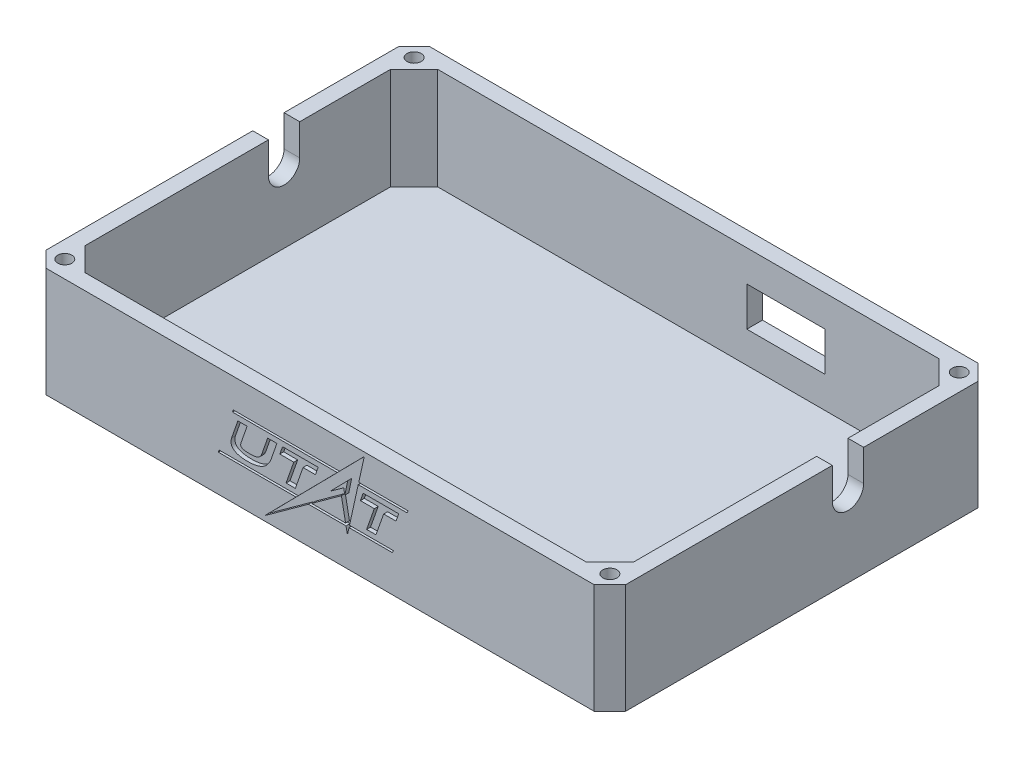
from build123d import *

# Parameters (mm, degrees)
SKETCH1_W           = 74
SKETCH1_H           = 49
SKETCH1_W_2         = 70
SKETCH1_H_2         = 45
BOSS_EXTRUDE1_DEPTH = 13
SKETCH2_W           = 74
SKETCH2_H           = 49
BOSS_EXTRUDE2_DEPTH = 1
CHAMFER1_SIZE       = 3
CHAMFER2_SIZE       = 2
SKETCH3_R           = 0.9
CUT_EXTRUDE1_DEPTH  = 6
CUT_EXTRUDE2_DEPTH  = 86
SKETCH5_W           = 10
SKETCH5_H           = 5
CUT_EXTRUDE3_DEPTH  = 6
CUT_EXTRUDE4_DEPTH  = 0.5
CUT_EXTRUDE5_START  = -0.5
CUT_EXTRUDE5_DEPTH  = 0.5


# Read off the part's stored shape, not the designer's step: Cut-Extrude5
with BuildPart() as part:
    # Sketch1 → Boss-Extrude1 (new body)
    with BuildSketch(Plane(origin=(0, 0, 0), x_dir=(1, 0, 0), z_dir=(0, 1, 0))):
        Rectangle(SKETCH1_W, SKETCH1_H)
        Rectangle(SKETCH1_W_2, SKETCH1_H_2, mode=Mode.SUBTRACT)
    extrude(amount=BOSS_EXTRUDE1_DEPTH)

    # Sketch2 → Boss-Extrude2 (add)
    with BuildSketch(Plane.XZ):
        Rectangle(SKETCH2_W, SKETCH2_H)
    extrude(amount=BOSS_EXTRUDE2_DEPTH)

    # Chamfer1
    chamfer1_edges = [part.edges().sort_by_distance(p)[0] for p in [
        (35, 6.5, 22.5),
        (35, 6.5, -22.5),
        (-35, 6.5, -22.5),
        (-35, 6.5, 22.5),
    ]]
    chamfer(chamfer1_edges, length=CHAMFER1_SIZE)

    # Chamfer2
    chamfer2_edges = [part.edges().sort_by_distance(p)[0] for p in [
        (37, 6, 24.5),
        (-37, 6, 24.5),
        (-37, 6, -24.5),
        (37, 6, -24.5),
    ]]
    chamfer(chamfer2_edges, length=CHAMFER2_SIZE)

    # Sketch3 → Cut-Extrude1 (cut)
    with BuildSketch(Plane(origin=(0, 13, 0), x_dir=(1, 0, 0), z_dir=(0, 1, 0))):
        with Locations(Location((-34.8, 22.3, 0), (0, 0, 270))):
            Circle(SKETCH3_R)
        with Locations(Location((34.8, 22.3, 0), (0, 0, 270))):
            Circle(SKETCH3_R)
        with Locations(Location((34.8, -22.3, 0), (0, 0, 270))):
            Circle(SKETCH3_R)
        with Locations(Location((-34.8, -22.3, 0), (0, 0, 270))):
            Circle(SKETCH3_R)
    extrude(amount=-CUT_EXTRUDE1_DEPTH, mode=Mode.SUBTRACT)

    # Sketch4 → Cut-Extrude2 (cut)
    with BuildSketch(Plane(origin=(37, 0, 0), x_dir=(0, 0, -1), z_dir=(1, 0, 0))):
        with BuildLine():
            Line((3.897991901, 9), (3.897991901, 13))
            Line((3.897991901, 13), (7.897991901, 13))
            Line((7.897991901, 13), (7.897991901, 9))
            ThreePointArc((7.897991901, 9), (5.897991901, 7), (3.897991901, 9))
        make_face()
    extrude(amount=-CUT_EXTRUDE2_DEPTH, mode=Mode.SUBTRACT)

    # Sketch5 → Cut-Extrude3 (cut)
    with BuildSketch(Plane(origin=(0, 0, -24.5), x_dir=(-1, 0, 0), z_dir=(0, 0, -1))):
        with Locations((-12.479644564, 6.5)):
            Rectangle(SKETCH5_W, SKETCH5_H)
    extrude(amount=-CUT_EXTRUDE3_DEPTH, mode=Mode.SUBTRACT)

    # Sketch7 → Cut-Extrude4 (cut)
    # profile 1 of 7: a face of its own
    with BuildSketch(Plane(origin=(0, 0, -24.5), x_dir=(-1, 0, 0), z_dir=(0, 0, -1))):
        with BuildLine():
            Line((1.708011202, 9.169338726), (4.117457984, 9.169338726))
            Line((4.117457984, 9.169338726), (4.117457984, 8.287394282))
            Line((4.117457984, 8.287394282), (2.460632062, 8.287394282))
            Line((2.460632062, 8.287394282), (2.253926333, 7.286726546))
            add(Edge.make_bspline(
                [(2.253926333, 7.286726546), (2.282092948, 7.294571304), (2.337643299, 7.310042778), (2.421329971, 7.325558709), (2.50243402, 7.335615642), (2.555654001, 7.336957103), (2.581475412, 7.337607957)],
                knots=[0, 0, 0, 0, 1.05461699, 2.079921384, 3.068411212, 4, 4, 4, 4], degree=3))
            add(Edge.make_bspline(
                [(2.581475412, 7.337607957), (2.63774297, 7.336318618), (2.748658723, 7.333777048), (2.910914395, 7.309649257), (3.066283785, 7.271648717), (3.214291448, 7.217452106), (3.354792798, 7.146913818), (3.487958152, 7.061582263), (3.613950947, 6.961307567), (3.730533021, 6.84602695), (3.8376535, 6.719446223), (3.930788647, 6.582535772), (4.010331875, 6.437247809), (4.073597808, 6.282679225), (4.123532677, 6.119800817), (4.159616727, 5.948508205), (4.180955029, 5.768598384), (4.183832369, 5.645858775), (4.185299864, 5.583259332)],
                knots=[0, 0, 0, 0, 1.01440847, 1.999622559, 2.951875003, 3.895578053, 4.836219714, 5.782137149, 6.743708247, 7.735272588, 8.734977101, 9.730283169, 10.717124674, 11.717316708, 12.737475749, 13.78628267, 14.87096371, 16, 16, 16, 16], degree=3))
            add(Edge.make_bspline(
                [(4.185299864, 5.583259332), (4.183506561, 5.519949241), (4.17996785, 5.395019923), (4.156881001, 5.211329636), (4.116132298, 5.03539581), (4.060159877, 4.866747474), (3.986419795, 4.706624153), (3.897737255, 4.553367088), (3.792612874, 4.408113859), (3.672078281, 4.272353486), (3.541041368, 4.1482659), (3.401517988, 4.039105812), (3.254488335, 3.947248483), (3.09994886, 3.873012231), (2.938786207, 3.81427783), (2.77095146, 3.77152199), (2.595628965, 3.747003891), (2.47660777, 3.743678534), (2.416110828, 3.741988299)],
                knots=[0, 0, 0, 0, 1.06808661, 2.107647099, 3.116961351, 4.110378221, 5.100014249, 6.085620622, 7.093190682, 8.119403071, 9.144090782, 10.133780668, 11.103064255, 12.062861538, 13.020824475, 13.992378307, 14.979551724, 16, 16, 16, 16], degree=3))
            add(Edge.make_bspline(
                [(2.416110828, 3.741988299), (2.362010214, 3.743371017), (2.255312481, 3.746098026), (2.098151404, 3.762859664), (1.946630673, 3.792494396), (1.801554698, 3.835383527), (1.661397038, 3.888170256), (1.527777954, 3.954190037), (1.399963187, 4.032185763), (1.278315682, 4.120734011), (1.16481204, 4.220480179), (1.061217941, 4.329669544), (0.966906216, 4.44692583), (0.883894987, 4.573695622), (0.812444469, 4.709791625), (0.749080692, 4.853609916), (0.697216806, 5.006652417), (0.670897377, 5.112749982), (0.657522086, 5.166667786)],
                knots=[0, 0, 0, 0, 1.054957082, 2.080596141, 3.077793124, 4.061112343, 5.027190972, 5.994718051, 6.962465889, 7.943658696, 8.924948258, 9.904494768, 10.875059, 11.855380583, 12.854004648, 13.869083016, 14.917087635, 16, 16, 16, 16], degree=3))
            Line((0.657522086, 5.166667786), (1.742992172, 5.166667786))
            add(Edge.make_bspline(
                [(1.742992172, 5.166667786), (1.762834591, 5.129304943), (1.801396069, 5.056694522), (1.874748524, 4.960293278), (1.956861941, 4.878086439), (2.046995612, 4.809270826), (2.145733547, 4.757715339), (2.249052362, 4.718618044), (2.358250006, 4.696025165), (2.432618424, 4.693200831), (2.470172327, 4.691774623)],
                knots=[0, 0, 0, 0, 1.104910296, 2.147267069, 3.153527244, 4.136738762, 5.099945312, 6.05603338, 7.018353, 8, 8, 8, 8], degree=3))
            add(Edge.make_bspline(
                [(2.470172327, 4.691774623), (2.496346893, 4.692759432), (2.547845794, 4.694697059), (2.623721281, 4.704947593), (2.696147766, 4.724361871), (2.765663724, 4.751246134), (2.832455892, 4.784773846), (2.895566781, 4.827100398), (2.956094407, 4.875819828), (3.013117294, 4.93172554), (3.064763594, 4.994047404), (3.110051749, 5.061016496), (3.150545605, 5.131144747), (3.180540023, 5.207210114), (3.205102916, 5.286941258), (3.223192023, 5.370939616), (3.234002305, 5.45930329), (3.235003048, 5.519626693), (3.235513539, 5.550398421)],
                knots=[0, 0, 0, 0, 0.978869489, 1.925942215, 2.855067702, 3.774946051, 4.70828698, 5.642468714, 6.60995405, 7.609372294, 8.622401667, 9.629904756, 10.629323, 11.642352373, 12.678539694, 13.745912462, 14.850161547, 16, 16, 16, 16], degree=3))
            add(Edge.make_bspline(
                [(3.235513539, 5.550398421), (3.234921055, 5.580455868), (3.233767769, 5.638963417), (3.224227561, 5.724873457), (3.207160313, 5.806386536), (3.183906041, 5.884126986), (3.154137796, 5.957622727), (3.117759012, 6.027311243), (3.074614273, 6.092840282), (3.024471945, 6.152875739), (2.971000682, 6.207941968), (2.913555365, 6.256102452), (2.852653544, 6.296072311), (2.790187668, 6.33096716), (2.723664325, 6.356362871), (2.654579357, 6.37385196), (2.583005417, 6.38668475), (2.534186386, 6.387438723), (2.509393414, 6.387821632)],
                knots=[0, 0, 0, 0, 1.166249705, 2.270133367, 3.348514167, 4.393962215, 5.415026464, 6.420877785, 7.440098956, 8.453121383, 9.451844239, 10.415694839, 11.355045125, 12.27538808, 13.187007209, 14.108269027, 15.039275622, 16, 16, 16, 16], degree=3))
            add(Edge.make_bspline(
                [(2.509393414, 6.387821632), (2.482462484, 6.386799753), (2.428487122, 6.384751688), (2.348293244, 6.368087129), (2.269066282, 6.341117622), (2.190365651, 6.303908912), (2.112972592, 6.255214452), (2.034844664, 6.198101433), (1.958596977, 6.128420052), (1.910116577, 6.076521201), (1.885036109, 6.04967226)],
                knots=[0, 0, 0, 0, 0.88288272, 1.769486374, 2.674910571, 3.623812639, 4.617874466, 5.670434592, 6.794841017, 8, 8, 8, 8], degree=3))
            Line((1.885036109, 6.04967226), (1.085773956, 6.233057342))
            Line((1.085773956, 6.233057342), (1.708011202, 9.169338726))
        make_face()
    # profile 2 of 7: a face of its own
    with BuildSketch(Plane(origin=(0, 0, -24.5), x_dir=(-1, 0, 0), z_dir=(0, 0, -1))):
        Polygon((4.761955847, 9.169338726), (5.776403964, 9.169338726), (7.136421659, 5.410474543), (8.499619442, 9.169338726), (9.510887471, 9.169338726), (7.592234293, 3.877672059), (6.677428937, 3.877672059), align=None)
    # profile 3 of 7: a face of its own
    with BuildSketch(Plane(origin=(0, 0, -24.5), x_dir=(-1, 0, 0), z_dir=(0, 0, -1))):
        Polygon((9.884017813, 2.927885735), (12.3189053, 9.305022487), (13.038665249, 9.305022487), (10.603777762, 2.927885735), align=None)
    # profile 4 of 7: a face of its own
    with BuildSketch(Plane(origin=(0, 0, -24.5), x_dir=(-1, 0, 0), z_dir=(0, 0, -1))):
        Polygon((13.547479351, 9.169338726), (16.939573368, 9.169338726), (16.939573368, 8.676425064), (14.605388673, 3.741988299), (13.763725345, 4.166000051), (15.714179405, 8.287394282), (13.547479351, 8.287394282), align=None)
    # profile 5 of 7: a face of its own
    with BuildSketch(Plane(origin=(0, 0, -24.5), x_dir=(-1, 0, 0), z_dir=(0, 0, -1))):
        with BuildLine():
            add(Edge.make_bspline(
                [(18.194648155, 4.963142145), (18.232989903, 4.961039959), (18.308478182, 4.956901118), (18.417548453, 4.92601338), (18.515985001, 4.87051916), (18.604000427, 4.798136567), (18.678424055, 4.711050644), (18.732215771, 4.611739796), (18.765713221, 4.503089788), (18.769411363, 4.427364013), (18.771304138, 4.388606221)],
                knots=[0, 0, 0, 0, 1.016957001, 2.002212695, 2.9757545, 3.99499976, 5.013036768, 5.994806404, 6.97370641, 8, 8, 8, 8], degree=3))
            add(Edge.make_bspline(
                [(18.771304138, 4.388606221), (18.769423763, 4.349842204), (18.765749847, 4.274104267), (18.731983972, 4.165242546), (18.678504437, 4.065115454), (18.603994456, 3.977096348), (18.516349503, 3.903349637), (18.41732213, 3.848367155), (18.308685959, 3.815727234), (18.233026474, 3.811814776), (18.194648155, 3.809830179)],
                knots=[0, 0, 0, 0, 1.023218912, 1.999186227, 2.986238111, 4.008388923, 5.030539734, 6.0011649, 6.986089706, 8, 8, 8, 8], degree=3))
            add(Edge.make_bspline(
                [(18.194648155, 3.809830179), (18.156260742, 3.811798638), (18.08058333, 3.815679282), (17.971778291, 3.848642277), (17.872019821, 3.902982553), (17.784352847, 3.977185802), (17.709509988, 4.064803771), (17.657550926, 4.165558465), (17.623470531, 4.274063225), (17.619846841, 4.349828309), (17.617992172, 4.388606221)],
                knots=[0, 0, 0, 0, 1.013427518, 1.99788335, 2.976245624, 3.997909735, 5.019573847, 6.001765691, 6.977268297, 8, 8, 8, 8], degree=3))
            add(Edge.make_bspline(
                [(17.617992172, 4.388606221), (17.619859077, 4.42737815), (17.623506674, 4.503131544), (17.657319788, 4.611420238), (17.709593262, 4.711364021), (17.784346605, 4.798046926), (17.872386201, 4.870883378), (17.971550698, 4.925742028), (18.080791002, 4.956949425), (18.15629727, 4.96105623), (18.194648155, 4.963142145)],
                knots=[0, 0, 0, 0, 1.025808215, 2.00424526, 2.981110158, 3.998665696, 5.017428914, 5.998734231, 6.983523959, 8, 8, 8, 8], degree=3))
        make_face()
    # profile 6 of 7: a face of its own
    with BuildSketch(Plane(origin=(0, 0, -24.5), x_dir=(-1, 0, 0), z_dir=(0, 0, -1))):
        with BuildLine():
            Line((20.432370177, 9.169338726), (22.841816958, 9.169338726))
            Line((22.841816958, 9.169338726), (22.841816958, 8.287394282))
            Line((22.841816958, 8.287394282), (21.184991037, 8.287394282))
            Line((21.184991037, 8.287394282), (20.978285308, 7.286726546))
            add(Edge.make_bspline(
                [(20.978285308, 7.286726546), (21.006451922, 7.294571304), (21.062002273, 7.310042778), (21.145688946, 7.325558709), (21.226792994, 7.335615642), (21.280012976, 7.336957103), (21.305834386, 7.337607957)],
                knots=[0, 0, 0, 0, 1.05461699, 2.079921384, 3.068411212, 4, 4, 4, 4], degree=3))
            add(Edge.make_bspline(
                [(21.305834386, 7.337607957), (21.362101944, 7.336318618), (21.473017697, 7.333777048), (21.635273369, 7.309649257), (21.79064276, 7.271648717), (21.938650422, 7.217452106), (22.079151772, 7.146913818), (22.212317126, 7.061582263), (22.338309921, 6.961307567), (22.454891995, 6.84602695), (22.562012474, 6.719446223), (22.655147622, 6.582535772), (22.734690849, 6.437247809), (22.797956783, 6.282679225), (22.847891651, 6.119800817), (22.883975702, 5.948508205), (22.905314004, 5.768598384), (22.908191343, 5.645858775), (22.909658839, 5.583259332)],
                knots=[0, 0, 0, 0, 1.01440847, 1.999622559, 2.951875003, 3.895578053, 4.836219714, 5.782137149, 6.743708247, 7.735272588, 8.734977101, 9.730283169, 10.717124674, 11.717316708, 12.737475749, 13.78628267, 14.87096371, 16, 16, 16, 16], degree=3))
            add(Edge.make_bspline(
                [(22.909658839, 5.583259332), (22.907865535, 5.519949241), (22.904326824, 5.395019923), (22.881239975, 5.211329636), (22.840491272, 5.03539581), (22.784518851, 4.866747474), (22.71077877, 4.706624153), (22.622096229, 4.553367088), (22.516971848, 4.408113859), (22.396437256, 4.272353486), (22.265400343, 4.1482659), (22.125876962, 4.039105812), (21.978847309, 3.947248483), (21.824307835, 3.873012231), (21.663145181, 3.81427783), (21.495310435, 3.77152199), (21.319987939, 3.747003891), (21.200966745, 3.743678534), (21.140469803, 3.741988299)],
                knots=[0, 0, 0, 0, 1.06808661, 2.107647099, 3.116961351, 4.110378221, 5.100014249, 6.085620622, 7.093190682, 8.119403071, 9.144090782, 10.133780668, 11.103064255, 12.062861538, 13.020824475, 13.992378307, 14.979551724, 16, 16, 16, 16], degree=3))
            add(Edge.make_bspline(
                [(21.140469803, 3.741988299), (21.086369188, 3.743371017), (20.979671455, 3.746098026), (20.822510378, 3.762859664), (20.670989647, 3.792494396), (20.525913673, 3.835383527), (20.385756012, 3.888170256), (20.252136928, 3.954190037), (20.124322161, 4.032185763), (20.002674657, 4.120734011), (19.889171014, 4.220480179), (19.785576916, 4.329669544), (19.69126519, 4.44692583), (19.608253961, 4.573695622), (19.536803443, 4.709791625), (19.473439666, 4.853609916), (19.42157578, 5.006652417), (19.395256352, 5.112749982), (19.381881061, 5.166667786)],
                knots=[0, 0, 0, 0, 1.054957082, 2.080596141, 3.077793124, 4.061112343, 5.027190972, 5.994718051, 6.962465889, 7.943658696, 8.924948258, 9.904494768, 10.875059, 11.855380583, 12.854004648, 13.869083016, 14.917087635, 16, 16, 16, 16], degree=3))
            Line((19.381881061, 5.166667786), (20.467351146, 5.166667786))
            add(Edge.make_bspline(
                [(20.467351146, 5.166667786), (20.487193566, 5.129304943), (20.525755043, 5.056694522), (20.599107499, 4.960293278), (20.681220916, 4.878086439), (20.771354587, 4.809270826), (20.870092522, 4.757715339), (20.973411336, 4.718618044), (21.082608981, 4.696025165), (21.156977398, 4.693200831), (21.194531301, 4.691774623)],
                knots=[0, 0, 0, 0, 1.104910296, 2.147267069, 3.153527244, 4.136738762, 5.099945312, 6.05603338, 7.018353, 8, 8, 8, 8], degree=3))
            add(Edge.make_bspline(
                [(21.194531301, 4.691774623), (21.220705868, 4.692759432), (21.272204768, 4.694697059), (21.348080255, 4.704947593), (21.420506741, 4.724361871), (21.490022699, 4.751246134), (21.556814867, 4.784773846), (21.619925756, 4.827100398), (21.680453381, 4.875819828), (21.737476268, 4.93172554), (21.789122568, 4.994047404), (21.834410723, 5.061016496), (21.874904579, 5.131144747), (21.904898998, 5.207210114), (21.92946189, 5.286941258), (21.947550997, 5.370939616), (21.958361279, 5.45930329), (21.959362022, 5.519626693), (21.959872514, 5.550398421)],
                knots=[0, 0, 0, 0, 0.978869489, 1.925942215, 2.855067702, 3.774946051, 4.70828698, 5.642468714, 6.60995405, 7.609372294, 8.622401667, 9.629904756, 10.629323, 11.642352373, 12.678539694, 13.745912462, 14.850161547, 16, 16, 16, 16], degree=3))
            add(Edge.make_bspline(
                [(21.959872514, 5.550398421), (21.959280029, 5.580455868), (21.958126744, 5.638963417), (21.948586536, 5.724873457), (21.931519288, 5.806386536), (21.908265015, 5.884126986), (21.878496771, 5.957622727), (21.842117986, 6.027311243), (21.798973247, 6.092840282), (21.748830919, 6.152875739), (21.695359657, 6.207941968), (21.637914339, 6.256102452), (21.577012518, 6.296072311), (21.514546642, 6.33096716), (21.448023299, 6.356362871), (21.378938332, 6.37385196), (21.307364392, 6.38668475), (21.25854536, 6.387438723), (21.233752388, 6.387821632)],
                knots=[0, 0, 0, 0, 1.166249705, 2.270133367, 3.348514167, 4.393962215, 5.415026464, 6.420877785, 7.440098956, 8.453121383, 9.451844239, 10.415694839, 11.355045125, 12.27538808, 13.187007209, 14.108269027, 15.039275622, 16, 16, 16, 16], degree=3))
            add(Edge.make_bspline(
                [(21.233752388, 6.387821632), (21.206821458, 6.386799753), (21.152846097, 6.384751688), (21.072652219, 6.368087129), (20.993425256, 6.341117622), (20.914724625, 6.303908912), (20.837331566, 6.255214452), (20.759203639, 6.198101433), (20.682955951, 6.128420052), (20.634475551, 6.076521201), (20.609395083, 6.04967226)],
                knots=[0, 0, 0, 0, 0.88288272, 1.769486374, 2.674910571, 3.623812639, 4.617874466, 5.670434592, 6.794841017, 8, 8, 8, 8], degree=3))
            Line((20.609395083, 6.04967226), (19.81013293, 6.233057342))
            Line((19.81013293, 6.233057342), (20.432370177, 9.169338726))
        make_face()
    # profile 7 of 7: a face of its own
    with BuildSketch(Plane(origin=(0, 0, -24.5), x_dir=(-1, 0, 0), z_dir=(0, 0, -1))):
        Polygon((25.556552201, 9.169338726), (26.437436616, 9.169338726), (28.574455847, 3.877672059), (27.56000773, 3.877672059), (27.14871633, 4.963142145), (24.843152428, 4.963142145), (24.431861029, 3.877672059), (23.418472941, 3.877672059), align=None)
        Polygon((25.996464394, 7.749959386), (25.203562418, 5.91292847), (26.789366371, 5.91292847), align=None, mode=Mode.SUBTRACT)
    extrude(amount=-CUT_EXTRUDE4_DEPTH, mode=Mode.SUBTRACT)

    # Cut-Extrude5 outline → Cut-Extrude5 (cut)
    # profile 1 of 4: a face of its own
    with BuildSketch(Plane.XY.offset(24.5).offset(CUT_EXTRUDE5_START)):
        with BuildLine():
            Line((-10.50206592, 8.367500935), (-11.308391838, 6.070654049))
            add(Edge.make_bspline(
                [(-11.308391838, 6.070654049), (-11.332280287, 5.985404354), (-11.353613364, 5.891683859), (-11.377708974, 5.705399033), (-11.380784042, 5.61205075), (-11.361381515, 5.429382876), (-11.338924366, 5.339890457), (-11.262220114, 5.168900529), (-11.207901122, 5.087468229), (-11.063456079, 4.937933292), (-10.973283154, 4.869905836), (-10.757497773, 4.751033556), (-10.63190267, 4.700190153), (-10.209879262, 4.574944553), (-9.867575561, 4.527515458), (-9.138582622, 4.499199604), (-8.752868494, 4.517621895), (-8.206159127, 4.606808604), (-8.029233672, 4.647069721), (-7.695838591, 4.75086934), (-7.53945811, 4.814497259), (-7.254768892, 4.963913792), (-7.126585763, 5.049689333), (-6.90021496, 5.237213783), (-6.802034424, 5.338755948), (-6.629133138, 5.549567539), (-6.553948115, 5.658519205), (-6.451448552, 5.826429911), (-6.41900449, 5.883242863), (-6.358218166, 5.999514798), (-6.329800491, 6.059009247), (-6.305360251, 6.12042051)],
                knots=[0, 0, 0, 0, 0.0625, 0.0625, 0.125, 0.125, 0.1875, 0.1875, 0.25, 0.25, 0.3125, 0.3125, 0.375, 0.375, 0.5, 0.5, 0.625, 0.625, 0.6875, 0.6875, 0.75, 0.75, 0.8125, 0.8125, 0.875, 0.875, 0.9375, 0.9375, 0.96875, 0.96875, 1, 1, 1, 1], degree=3))
            Line((-6.305360251, 6.12042051), (-5.516505443, 8.367500935))
            Line((-5.516505443, 8.367500935), (-6.697855497, 8.367500967))
            Line((-6.697855497, 8.367500967), (-7.453951189, 6.213735475))
            add(Edge.make_bspline(
                [(-7.453951189, 6.213735475), (-7.470130504, 6.179684665), (-7.490693568, 6.137489646), (-7.537049291, 6.042608942), (-7.563513364, 5.990386993), (-7.630371629, 5.887253326), (-7.670996921, 5.836468896), (-7.771895905, 5.744028321), (-7.832184643, 5.702354229), (-7.972236154, 5.630981048), (-8.051931426, 5.601221349), (-8.22597153, 5.553070358), (-8.320238033, 5.534622956), (-8.614436324, 5.493090634), (-8.825008508, 5.48335732), (-9.222898445, 5.484514007), (-9.410180752, 5.495135854), (-9.731053074, 5.537103518), (-9.865236078, 5.568764126), (-10.011889277, 5.644685047), (-10.051654008, 5.674859658), (-10.110923474, 5.746403275), (-10.130323106, 5.787894331), (-10.149068471, 5.880115812), (-10.148188582, 5.931022939), (-10.13363287, 6.032060374), (-10.119549319, 6.082377695), (-10.11084506, 6.120420542)],
                knots=[0, 0, 0, 0, 0.0625, 0.0625, 0.125, 0.125, 0.1875, 0.1875, 0.25, 0.25, 0.3125, 0.3125, 0.375, 0.375, 0.5, 0.5, 0.625, 0.625, 0.75, 0.75, 0.8125, 0.8125, 0.875, 0.875, 0.9375, 0.9375, 1, 1, 1, 1], degree=3))
            Line((-10.11084506, 6.120420542), (-9.321989507, 8.367500935))
            Line((-9.321989507, 8.367500935), (-10.50206592, 8.367500935))
        make_face()
    # profile 2 of 4: a face of its own
    with BuildSketch(Plane.XY.offset(24.5).offset(CUT_EXTRUDE5_START)):
        Polygon((9.692388571, 7.378743697), (10.041267968, 8.367500935), (5.491848088, 8.367500935), (5.142526127, 7.372444976), (6.920374728, 7.372444976), (5.937367476, 4.586499293), (7.127079166, 4.586499293), (8.112308181, 7.378743697), align=None)
    # profile 3 of 4: a face of its own
    with BuildSketch(Plane.XY.offset(24.5).offset(CUT_EXTRUDE5_START)):
        Polygon((-0.599274241, 7.372444976), (-0.25002604, 8.367500935), (-4.797560551, 8.367500935), (-5.148660593, 7.372444976), (-3.365488925, 7.372444976), (-4.34847159, 4.571795199), (-3.163960033, 4.571795199), (-2.180977367, 7.372444976), align=None)
    # profile 4 of 4: a face of its own
    with BuildSketch(Plane.XY.offset(24.5).offset(CUT_EXTRUDE5_START)):
        Polygon((4.930240459, 9.286284927), (5.64073304, 12.5029375), (2.4692064, 9.286888424), (-11.082185261, 9.286888424), (-11.189742961, 9.002769847), (2.193761415, 9.002769847), (-2.790075742, 3.948968943), (-12.896867857, 3.948968943), (-13.000527971, 3.658133108), (-3.07688547, 3.658133108), (-7.067944311, -0.388952749), (-1.484134995, 3.658133108), (3.308158911, 3.658133108), (3.491228617, 2.771373574), (3.687930651, 3.661918376), (9.24233178, 3.661918376), (9.348826654, 3.948968943), (3.751335836, 3.948968943), (4.867617584, 9.002769847), (11.110436715, 9.002769847), (11.215621776, 9.286284927), align=None)
        Polygon((-1.082171329, 3.949472416), (2.716284789, 6.702553775), (3.247744388, 3.949472416), align=None, mode=Mode.SUBTRACT)
        Polygon((3.528133578, 8.7716696), (3.153804488, 6.988372762), (3.015221454, 7.722294439), (1.295260511, 6.49602424), align=None, mode=Mode.SUBTRACT)
    extrude(amount=CUT_EXTRUDE5_DEPTH, mode=Mode.SUBTRACT)


solid = part.part
